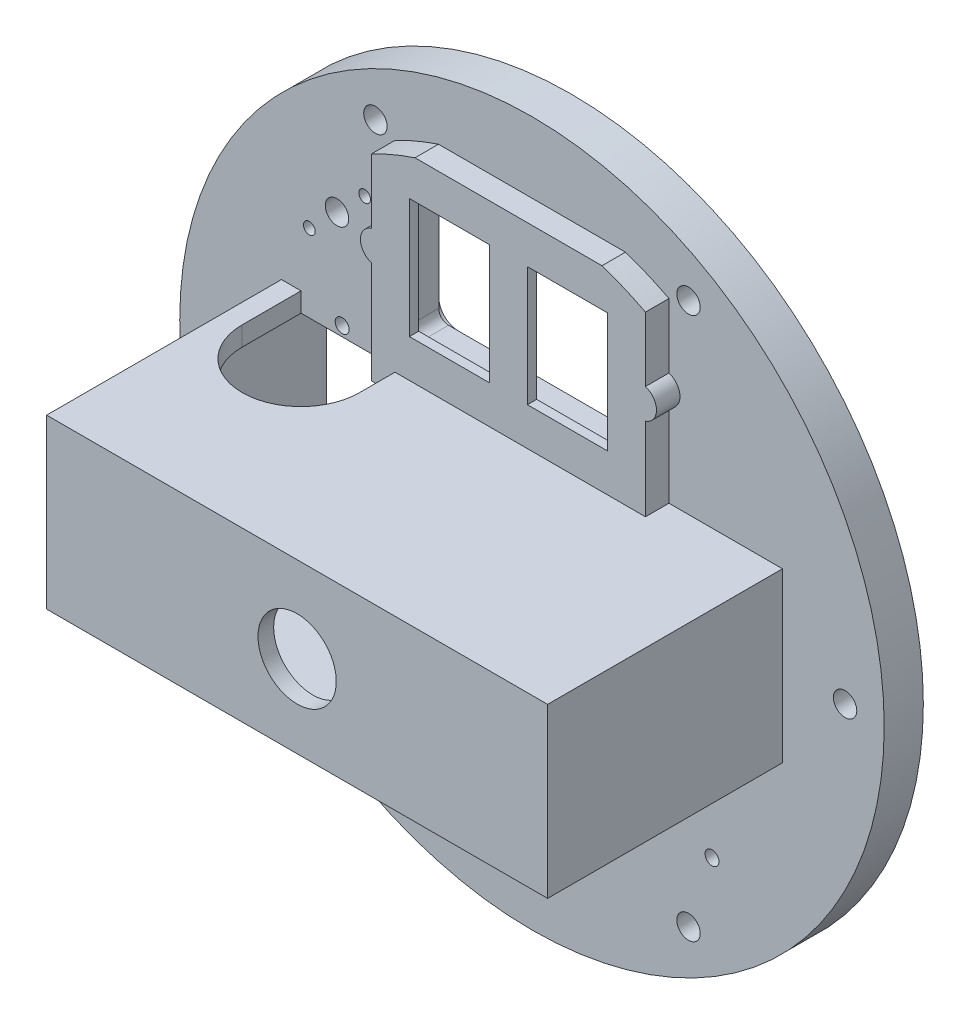
from build123d import *
from build123d.topology import SkipClean

# Parameters (mm, degrees)
SKETCH1_R                                       = 57.15
BOSS_EXTRUDE1_DEPTH                             = 6.35
SKETCH2_W                                       = 44.45
SKETCH2_H                                       = 31.75
BOSS_EXTRUDE2_DEPTH                             = 3.81
SKETCH3_W                                       = 13
SKETCH3_H                                       = 19.4
CUT_EXTRUDE1_DEPTH                              = 82.458397971
SKETCH4_W                                       = 39.77
SKETCH4_H                                       = 27.02
CUT_EXTRUDE2_DEPTH                              = 8.66
FILLET1_R                                       = 1.5875
CUT_EXTRUDE3_DEPTH                              = 1.5875
CBORE_FOR_6_PAN_HEAD_MACHINE_SCREW1_D           = 3.7973
CBORE_FOR_6_PAN_HEAD_MACHINE_SCREW1_CBORE_D     = 7.54126
CBORE_FOR_6_PAN_HEAD_MACHINE_SCREW1_CBORE_DEPTH = 2.4638
CIRPATTERN1_COUNT                               = 6
SKETCH11_W                                      = 76.2
SKETCH11_H                                      = 21.59
CUT_EXTRUDE4_DEPTH                              = 82.458397971
CUT_EXTRUDE5_DEPTH                              = 1.5875
SKETCH15_W                                      = 81.28
SKETCH15_H                                      = 27.26529526
SKETCH15_W_2                                    = 76.2
SKETCH15_H_2                                    = 21.59
BOSS_EXTRUDE3_DEPTH                             = 38.1
CUT_EXTRUDE6_REACH                              = 103.045
SKETCH16_W                                      = 25.4
SKETCH16_H                                      = 25.4
FILLET2_R                                       = 12.7
SKETCH17_W                                      = 81.28
SKETCH17_H                                      = 27.26529526
BOSS_EXTRUDE4_DEPTH                             = 2.54
F_4_40_TAPPED_HOLE1_D                           = 2.2606
F_4_40_TAPPED_HOLE1_DEPTH                       = 7.5946
F_4_40_TAPPED_HOLE1_TIP                         = 0.679152758
BOSS_EXTRUDE5_DEPTH                             = 3.81
SKETCH18_R                                      = 1.905
CUT_EXTRUDE7_DEPTH                              = 93.239077944
SKETCH19_R                                      = 0.9525
CUT_EXTRUDE8_DEPTH                              = 4.7625
CUT_EXTRUDE9_REACH                              = 103.461
CUT_EXTRUDE11_START                             = -8.273753
SKETCH23_R                                      = 1.1303
CUT_EXTRUDE11_DEPTH                             = 8.273753
F_4_40_TAPPED_HOLE2_AT_2_COUNT                  = 2
F_4_40_TAPPED_HOLE2_AT_2_PITCH                  = 12.7
LPATTERN1_COUNT                                 = 6
LPATTERN1_PITCH                                 = 12.7
SKETCH26_R                                      = 6.35
CUT_EXTRUDE12_DEPTH                             = 93.239077944
SKETCH27_R                                      = 63.5
SKETCH27_R_2                                    = 48.133
CUT_EXTRUDE14_DEPTH                             = 90.352420225


with BuildPart() as part:
    # Sketch1 → Boss-Extrude1 (new body)
    with BuildSketch(Plane.XY):
        Circle(SKETCH1_R)
    extrude(amount=BOSS_EXTRUDE1_DEPTH)

    # Sketch2 → Boss-Extrude2 (add)
    with BuildSketch(Plane.XY.offset(6.35)):
        with Locations((0, 29.80529526)):
            Rectangle(SKETCH2_W, SKETCH2_H)
    extrude(amount=BOSS_EXTRUDE2_DEPTH)

    # Sketch3 → Cut-Extrude1 (cut, through all)
    with BuildSketch(Plane.XY.offset(10.16)):
        with Locations((-9.575, 29.80529526)):
            Rectangle(SKETCH3_W, SKETCH3_H)
        with Locations((9.575, 29.80529526)):
            Rectangle(SKETCH3_W, SKETCH3_H)
    extrude(amount=-CUT_EXTRUDE1_DEPTH, mode=Mode.SUBTRACT)

    # Sketch4 → Cut-Extrude2 (cut)
    with BuildSketch(Plane(origin=(0, 0, 0), x_dir=(-1, 0, 0), z_dir=(0, 0, -1))):
        with Locations((0, 29.80529526)):
            Rectangle(SKETCH4_W, SKETCH4_H)
    extrude(amount=-CUT_EXTRUDE2_DEPTH, mode=Mode.SUBTRACT)

    # Fillet1
    fillet1_edges = [part.edges().sort_by_distance(p)[0] for p in [
        (-19.885, 16.29529526, 4.33),
        (-19.885, 43.31529526, 4.33),
        (19.885, 43.31529526, 4.33),
        (19.885, 16.29529526, 4.33),
    ]]
    fillet(fillet1_edges, radius=FILLET1_R)

    # Sketch8 → Cut-Extrude3 (cut)
    with BuildSketch(Plane(origin=(0, 0, 0), x_dir=(-1, 0, 0), z_dir=(0, 0, -1))):
        with BuildLine():
            Line((18.2975, 44.90279526), (-18.2975, 44.90279526))
            ThreePointArc((-18.2975, 44.90279526), (-20.54256403, 43.97285929), (-21.4725, 41.72779526))
            Line((-21.4725, 41.72779526), (-21.4725, 32.98029526))
            ThreePointArc((-21.4725, 32.98029526), (-24.6475, 29.80529526), (-21.4725, 26.63029526))
            Line((-21.4725, 26.63029526), (-21.4725, 17.88279526))
            ThreePointArc((-21.4725, 17.88279526), (-20.54256403, 15.637731229), (-18.2975, 14.70779526))
            Line((-18.2975, 14.70779526), (18.2975, 14.70779526))
            ThreePointArc((18.2975, 14.70779526), (20.54256403, 15.637731229), (21.4725, 17.88279526))
            Line((21.4725, 17.88279526), (21.4725, 26.63029526))
            ThreePointArc((21.4725, 26.63029526), (24.6475, 29.80529526), (21.4725, 32.98029526))
            Line((21.4725, 32.98029526), (21.4725, 41.72779526))
            ThreePointArc((21.4725, 41.72779526), (20.54256403, 43.97285929), (18.2975, 44.90279526))
        make_face()
    extrude(amount=-CUT_EXTRUDE3_DEPTH, mode=Mode.SUBTRACT)

    # CBORE for #6 Pan Head Machine Screw1 (through all)
    with Locations(Plane(origin=(0, 0, 0), x_dir=(-1, 0, 0), z_dir=(0, 0, -1))):
        with Locations((-50.8, 0)):
            cbore_for_6_pan_head_machine_screw1 = CounterBoreHole(CBORE_FOR_6_PAN_HEAD_MACHINE_SCREW1_D / 2, CBORE_FOR_6_PAN_HEAD_MACHINE_SCREW1_CBORE_D / 2, CBORE_FOR_6_PAN_HEAD_MACHINE_SCREW1_CBORE_DEPTH)

    # CirPattern1: CBORE for #6 Pan Head Machine Screw1 ×6 about axis
    cirpattern1_axis = Axis((0, 0, 0), (0, 0, 1))
    for i in range(1, CIRPATTERN1_COUNT):
        add(cbore_for_6_pan_head_machine_screw1.rotate(cirpattern1_axis, i * 360 / CIRPATTERN1_COUNT), mode=Mode.SUBTRACT)

    # Sketch11 → Cut-Extrude4 (cut, through all)
    with BuildSketch(Plane(origin=(0, 0, 0), x_dir=(-1, 0, 0), z_dir=(0, 0, -1))):
        Rectangle(SKETCH11_W, SKETCH11_H)
    extrude(amount=-CUT_EXTRUDE4_DEPTH, mode=Mode.SUBTRACT)

    # Sketch12 → Cut-Extrude5 (cut)
    with BuildSketch(Plane(origin=(0, 0, 0), x_dir=(-1, 0, 0), z_dir=(0, 0, -1))):
        with BuildLine():
            Line((-39.6875, 12.3825), (-33.9725, 12.3825))
            ThreePointArc((-33.9725, 12.3825), (-30.7975, 15.5575), (-27.6225, 12.3825))
            Line((-27.6225, 12.3825), (27.6225, 12.3825))
            ThreePointArc((27.6225, 12.3825), (30.7975, 15.5575), (33.9725, 12.3825))
            Line((33.9725, 12.3825), (39.6875, 12.3825))
            Line((39.6875, 12.3825), (39.6875, -12.3825))
            Line((39.6875, -12.3825), (3.175, -12.3825))
            ThreePointArc((3.175, -12.3825), (0, -15.5575), (-3.175, -12.3825))
            Line((-3.175, -12.3825), (-39.6875, -12.3825))
            Line((-39.6875, -12.3825), (-39.6875, 12.3825))
        make_face()
    extrude(amount=-CUT_EXTRUDE5_DEPTH, mode=Mode.SUBTRACT)

    # Sketch15 → Boss-Extrude3 (add)
    with BuildSketch(Plane.XY.offset(6.35)):
        with Locations((0, 0.29764763)):
            Rectangle(SKETCH15_W, SKETCH15_H)
        Rectangle(SKETCH15_W_2, SKETCH15_H_2, mode=Mode.SUBTRACT)
    extrude(amount=BOSS_EXTRUDE3_DEPTH)

    # Sketch16 → Cut-Extrude6 (cut, up to next)
    with BuildSketch(Plane.XZ.offset(13.335), mode=Mode.PRIVATE) as cut_extrude6_sk1:
        with Locations((17.323292084, 19.05)):
            Rectangle(SKETCH16_W, SKETCH16_H)
    cut_extrude6_tool1 = extrude(cut_extrude6_sk1.sketch, amount=-CUT_EXTRUDE6_REACH, mode=Mode.PRIVATE) & part.part
    add(cut_extrude6_tool1.solids().sort_by_distance((17.323292, -13.335, 19.05))[0], mode=Mode.SUBTRACT)

    # Fillet2
    fillet2_edges = [part.edges().sort_by_distance(p)[0] for p in [
        (4.623292084, -12.065, 31.75),
        (30.023292084, -12.065, 31.75),
    ]]
    fillet(fillet2_edges, radius=FILLET2_R - 0.0001)  # a hair under: the kernel refuses the full size

    # Sketch17 → Boss-Extrude4 (add)
    with BuildSketch(Plane.XY.offset(44.45)):
        with Locations((0, 0.29764763)):
            Rectangle(SKETCH17_W, SKETCH17_H)
    extrude(amount=-BOSS_EXTRUDE4_DEPTH)

    # #4-40 Tapped Hole1
    with Locations(Plane(origin=(0, 0, 1.5875), x_dir=(-1, 0, 0), z_dir=(0, 0, -1))):
        with Locations((0, -12.3825), (30.7975, 12.3825), (21.4725, 29.80529526), (-21.4725, 29.80529526), (-30.7975, 12.3825)):
            Hole(F_4_40_TAPPED_HOLE1_D / 2, depth=F_4_40_TAPPED_HOLE1_DEPTH)
            with Locations((0, 0, -(F_4_40_TAPPED_HOLE1_DEPTH + F_4_40_TAPPED_HOLE1_TIP / 2))):  # 118° drill point
                Cone(0, F_4_40_TAPPED_HOLE1_D / 2, F_4_40_TAPPED_HOLE1_TIP, mode=Mode.SUBTRACT)

    # Sketch21 → Boss-Extrude5 (add)
    with SkipClean():  # the faces are left unmerged after this step: merging them gives an invalid solid
        with BuildSketch(Plane.XY.offset(10.16)):
            with BuildLine():
                Line((-21.4725, 32.34529526), (-21.4725, 27.26529526))
                ThreePointArc((-21.4725, 27.26529526), (-24.0125, 29.80529526), (-21.4725, 32.34529526))
            make_face()
            with BuildLine():
                Line((21.4725, 32.34529526), (21.4725, 27.26529526))
                ThreePointArc((21.4725, 27.26529526), (24.0125, 29.80529526), (21.4725, 32.34529526))
            make_face()
        extrude(amount=-BOSS_EXTRUDE5_DEPTH)

    # Sketch18 → Cut-Extrude7 (cut, through all)
    with SkipClean():  # the faces are left unmerged after this step: merging them gives an invalid solid
        with BuildSketch(Plane(origin=(0, 0, 0), x_dir=(-1, 0, 0), z_dir=(0, 0, -1))):
            with Locations((31.6325, 27.90029526)):
                Circle(SKETCH18_R)
        extrude(amount=-CUT_EXTRUDE7_DEPTH, mode=Mode.SUBTRACT)

    # Sketch19 → Cut-Extrude8 (cut)
    with SkipClean():  # the faces are left unmerged after this step: merging them gives an invalid solid
        with BuildSketch(Plane.XY.offset(6.35)):
            with Locations((-36.122628061, 23.410167199)):
                Circle(SKETCH19_R)
            with Locations((-27.142371939, 32.39042332)):
                Circle(SKETCH19_R)
        extrude(amount=-CUT_EXTRUDE8_DEPTH, mode=Mode.SUBTRACT)

    # Sketch20 → Cut-Extrude9 (cut, up to next)
    with BuildSketch(Plane(origin=(0, 13.93029526, 0), x_dir=(1, 0, 0), z_dir=(0, 1, 0)), mode=Mode.PRIVATE) as cut_extrude9_sk1:
        with BuildLine():
            Line((-37.465, -15.9004), (-37.465, -6.35))
            Line((-37.465, -6.35), (-22.225, -6.35))
            Line((-22.225, -6.35), (-22.225, -10.16))
            Line((-22.225, -10.16), (-18.415, -10.16))
            Line((-18.415, -10.16), (-18.415, -15.9004))
            ThreePointArc((-18.415, -15.9004), (-27.94, -25.4254), (-37.465, -15.9004))
        make_face()
    cut_extrude9_tool1 = extrude(cut_extrude9_sk1.sketch, amount=-CUT_EXTRUDE9_REACH, mode=Mode.PRIVATE) & part.part
    add(cut_extrude9_tool1.solids().sort_by_distance((-28.296895, 13.930295, 15.31418))[0], mode=Mode.SUBTRACT)

    # Sketch23 → Cut-Extrude11 (cut)
    with BuildSketch(Plane(origin=(0, 0, 1.5875), x_dir=(-1, 0, 0), z_dir=(0, 0, -1)).offset(CUT_EXTRUDE11_START)):
        with Locations((-21.4725, 29.80529526)):
            Circle(SKETCH23_R)
        with Locations((21.4725, 29.80529526)):
            Circle(SKETCH23_R)
    extrude(amount=CUT_EXTRUDE11_DEPTH, mode=Mode.SUBTRACT)

    # Sketch25 → #4-40 Tapped Hole2 (revolve, cut)
    with BuildSketch(Plane(origin=(-34.29, -19.685, 6.35), x_dir=(0, -1, 0), z_dir=(1, 0, 0))):
        Polygon((0, 0), (0, 5.454352758), (1.1303, 4.7752), (1.1303, 0), align=None)
    f_4_40_tapped_hole2 = revolve(axis=Axis((-34.29, -19.685, 12.7), (0, 0, -1)), mode=Mode.SUBTRACT)

    # #4-40 Tapped Hole2 at 2: #4-40 Tapped Hole2 ×2
    with Locations(*[(0, -i * F_4_40_TAPPED_HOLE2_AT_2_PITCH, 0) for i in range(1, F_4_40_TAPPED_HOLE2_AT_2_COUNT)]):
        add(f_4_40_tapped_hole2, mode=Mode.SUBTRACT)

    # LPattern1: #4-40 Tapped Hole2 ×6
    with Locations(*[(i * LPATTERN1_PITCH, 0, 0) for i in range(1, LPATTERN1_COUNT)]):
        add(f_4_40_tapped_hole2, mode=Mode.SUBTRACT)

    # LPattern1 copy 1 sketch → LPattern1 copy 1 (revolve, cut)
    with BuildSketch(Plane(origin=(-21.59, -32.385, 6.35), x_dir=(0, -1, 0), z_dir=(1, 0, 0))):
        Polygon((0, 0), (0, 5.454352758), (1.1303, 4.7752), (1.1303, 0), align=None)
    revolve(axis=Axis((-21.59, -32.385, 12.7), (0, 0, -1)), mode=Mode.SUBTRACT)

    # LPattern1 copy 2 sketch → LPattern1 copy 2 (revolve, cut)
    with BuildSketch(Plane(origin=(-8.89, -32.385, 6.35), x_dir=(0, -1, 0), z_dir=(1, 0, 0))):
        Polygon((0, 0), (0, 5.454352758), (1.1303, 4.7752), (1.1303, 0), align=None)
    revolve(axis=Axis((-8.89, -32.385, 12.7), (0, 0, -1)), mode=Mode.SUBTRACT)

    # LPattern1 copy 3 sketch → LPattern1 copy 3 (revolve, cut)
    with BuildSketch(Plane(origin=(3.81, -32.385, 6.35), x_dir=(0, -1, 0), z_dir=(1, 0, 0))):
        Polygon((0, 0), (0, 5.454352758), (1.1303, 4.7752), (1.1303, 0), align=None)
    revolve(axis=Axis((3.81, -32.385, 12.7), (0, 0, -1)), mode=Mode.SUBTRACT)

    # LPattern1 copy 4 sketch → LPattern1 copy 4 (revolve, cut)
    with BuildSketch(Plane(origin=(16.51, -32.385, 6.35), x_dir=(0, -1, 0), z_dir=(1, 0, 0))):
        Polygon((0, 0), (0, 5.454352758), (1.1303, 4.7752), (1.1303, 0), align=None)
    revolve(axis=Axis((16.51, -32.385, 12.7), (0, 0, -1)), mode=Mode.SUBTRACT)

    # LPattern1 copy 5 sketch → LPattern1 copy 5 (revolve, cut)
    with BuildSketch(Plane(origin=(29.21, -32.385, 6.35), x_dir=(0, -1, 0), z_dir=(1, 0, 0))):
        Polygon((0, 0), (0, 5.454352758), (1.1303, 4.7752), (1.1303, 0), align=None)
    revolve(axis=Axis((29.21, -32.385, 12.7), (0, 0, -1)), mode=Mode.SUBTRACT)

    # Sketch26 → Cut-Extrude12 (cut, through all)
    with BuildSketch(Plane(origin=(0, 0, 0), x_dir=(-1, 0, 0), z_dir=(0, 0, -1))):
        Circle(SKETCH26_R)
    extrude(amount=-CUT_EXTRUDE12_DEPTH, mode=Mode.SUBTRACT)

    # Sketch27 → Cut-Extrude14 (cut, through all)
    with BuildSketch(Plane.XY.offset(6.35)):
        Circle(SKETCH27_R)
        Circle(SKETCH27_R_2, mode=Mode.SUBTRACT)
    extrude(amount=CUT_EXTRUDE14_DEPTH, mode=Mode.SUBTRACT)


solid = part.part
